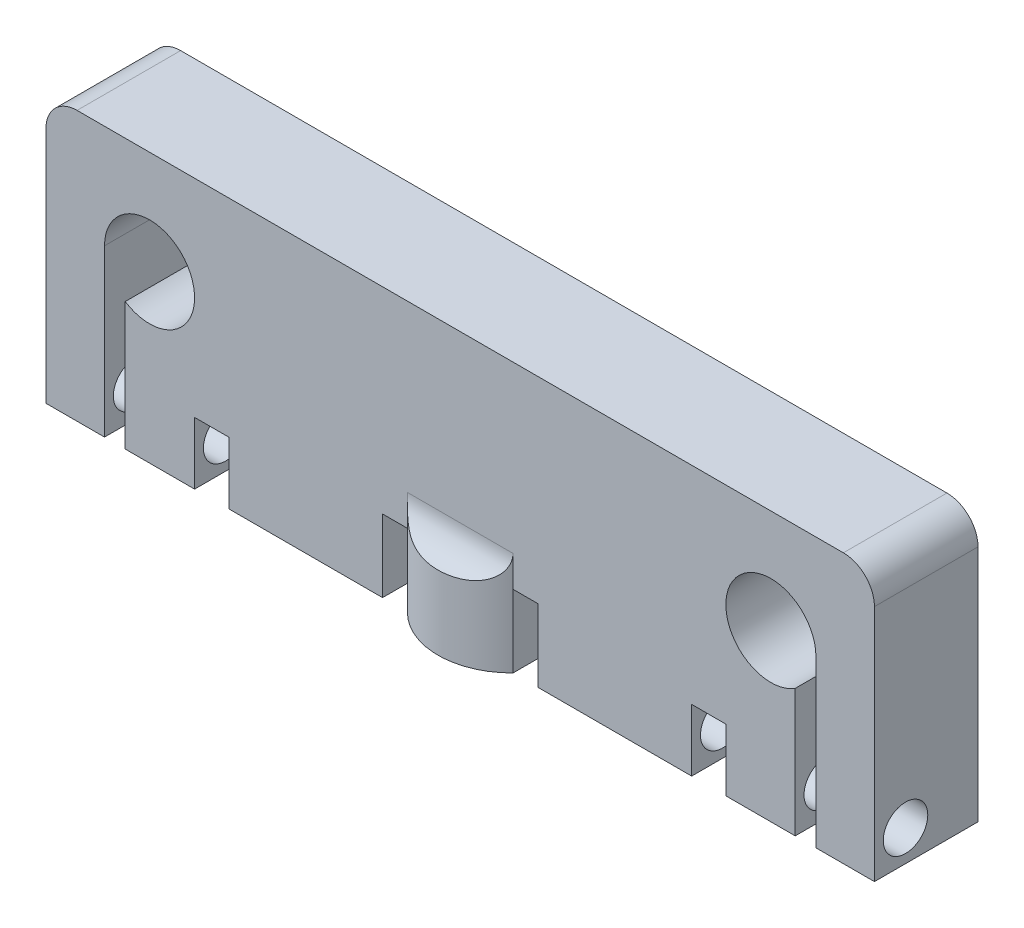
from build123d import *

# Parameters (mm, degrees)
BOSS_EXTRUDE1_DEPTH = 5
SKETCH2_W           = 3.3
SKETCH2_H           = 6
CUT_EXTRUDE2_DEPTH  = 6.5
SKETCH3_R           = 2.15
CUT_EXTRUDE4_DEPTH  = 24
FILLET1_R           = 0.5
FILLET2_R           = 3
BOSS_EXTRUDE2_DEPTH = 7
FILLET3_R           = 3


with BuildPart() as part:
    # Sketch1 → Boss-Extrude1 (new, symmetric)
    with BuildSketch(Plane.XY):
        with BuildLine():
            Line((40, -13), (34.35, -13))
            Line((34.35, -13), (34.35, 3))
            ThreePointArc((34.35, 3), (26.182605601, 5.085665361), (32.35, -0.660601044))
            Line((32.35, -0.660601044), (32.35, -13))
            Line((32.35, -13), (7.5, -13))
            Line((7.5, -13), (7.5, -6))
            Line((7.5, -6), (5.1, -6))
            Line((5.1, -6), (5.1, -13))
            Line((5.1, -13), (-5.1, -13))
            Line((-5.1, -13), (-5.1, -6))
            Line((-5.1, -6), (-7.5, -6))
            Line((-7.5, -6), (-7.5, -13))
            Line((-7.5, -13), (-32.35, -13))
            Line((-32.35, -13), (-32.35, -0.660601044))
            ThreePointArc((-32.35, -0.660601044), (-26.182605601, 5.085665361), (-34.35, 3))
            Line((-34.35, 3), (-34.35, -13))
            Line((-34.35, -13), (-40, -13))
            Line((-40, -13), (-40, 13))
            Line((-40, 13), (40, 13))
            Line((40, 13), (40, -13))
        make_face()
    extrude(amount=BOSS_EXTRUDE1_DEPTH, both=True)

    # Sketch2 → Cut-Extrude2 (cut)
    with BuildSketch(Plane.XY.offset(5)):
        with Locations((-24, -10)):
            Rectangle(SKETCH2_W, SKETCH2_H)
        with Locations((24, -10)):
            Rectangle(SKETCH2_W, SKETCH2_H)
    extrude(amount=-CUT_EXTRUDE2_DEPTH, mode=Mode.SUBTRACT)

    # Sketch3 → Cut-Extrude4 (cut)
    with BuildSketch(Plane.ZY.offset(40)):
        with Locations(Location((2, -10, 0), (0, 0, 180))):
            Circle(SKETCH3_R)
    cut_extrude4 = extrude(amount=-CUT_EXTRUDE4_DEPTH, mode=Mode.SUBTRACT)

    # Mirror1: Cut-Extrude4 across plane
    add(cut_extrude4.mirror(Plane(origin=(0, 0, 0), x_dir=(0, 0, 1), z_dir=(1, 0, 0))), mode=Mode.SUBTRACT)

    # Fillet1
    fillet1_edges = [part.edges().sort_by_distance(p)[0] for p in [
        (5.1, -9.5, -5),
        (-5.1, -9.5, -5),
    ]]
    fillet(fillet1_edges, radius=FILLET1_R)

    # Fillet2
    fillet2_edges = [part.edges().sort_by_distance(p)[0] for p in [
        (-40, 13, 0),
        (40, 13, 0),
    ]]
    fillet(fillet2_edges, radius=FILLET2_R)

    # Sketch4 → Boss-Extrude2 (add)
    with BuildSketch(Plane.XZ.offset(13)):
        with BuildLine():
            Line((-5.1, 5), (5.1, 5))
            ThreePointArc((5.1, 5), (0, 7.142128534), (-5.1, 5))
        make_face()
    extrude(amount=-BOSS_EXTRUDE2_DEPTH)

    # Fillet3
    # the kernel refuses this fillet: 3 mm, written as the material it adds along each edge
    with BuildSketch(Plane(origin=(-12.6, -6, 5), x_dir=(0, 1, 0), z_dir=(1, 0, 0))) as fillet3_piece_1_section:
        with BuildLine():
            CenterArc((FILLET3_R, FILLET3_R), FILLET3_R, 180, 90)
            Line((0, FILLET3_R), (0, 0))
            Line((0, 0), (FILLET3_R, 0))
        make_face()
    fillet3_piece_1 = extrude(amount=25.2, mode=Mode.PRIVATE)
    fillet3_piece_1 = fillet3_piece_1 & Plane(origin=(0, -5.25920744, 0), x_dir=(0.7140728391445785, 0, 0.7000714109260576), z_dir=(0, -1, 0)) * Cylinder(7.142128534, 63, mode=Mode.PRIVATE)
    add(fillet3_piece_1)


solid = part.part
